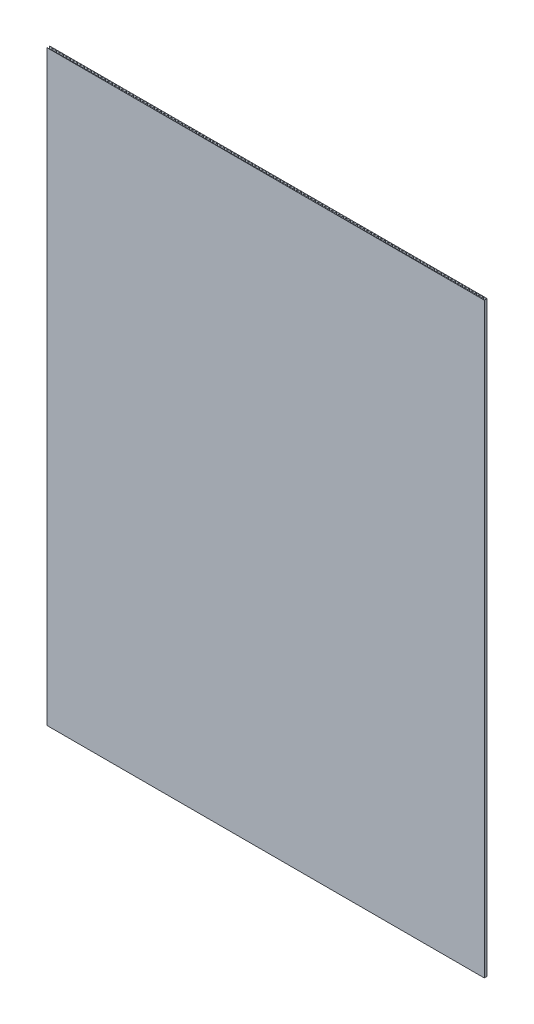
from build123d import *

# Parameters (mm, degrees)
BOSS_EXTRUDE1_DEPTH = 1678
LPATTERN1_COUNT     = 125
LPATTERN1_PITCH     = 10


with BuildPart() as part:
    # Sketch1 → Boss-Extrude1 (new body)
    with BuildSketch(Plane(origin=(0, 0, 0), x_dir=(1, 0, 0), z_dir=(0, 1, 0))):
        Polygon((5, -4), (-5.3, -4), (-5.3, -3.7), (4.7, -3.7), (4.7, 3.7), (-5.3, 3.7), (-5.3, 4), (5, 4), align=None)
    boss_extrude1 = extrude(amount=BOSS_EXTRUDE1_DEPTH)

    # LPattern1: Boss-Extrude1 ×125
    with Locations(*[(i * LPATTERN1_PITCH, 0, 0) for i in range(1, LPATTERN1_COUNT)]):
        add(boss_extrude1)


solid = part.part
